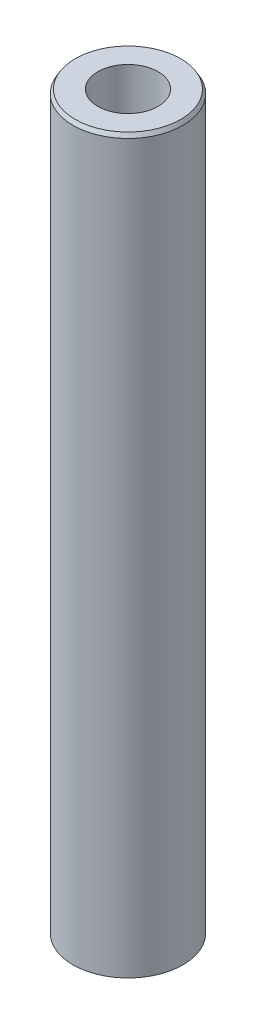
from build123d import *
from OCP.BRepFilletAPI import BRepFilletAPI_MakeChamfer

# Parameters (mm, degrees)
SKETCH1_R           = 45
BOSS_EXTRUDE1_DEPTH = 600
SKETCH2_R           = 24.650377463
CUT_EXTRUDE1_DEPTH  = 604.365560834
CHAMFER1_SIZE       = 3.245424574
CHAMFER1_SIZE2      = 1.873746751


with BuildPart() as part:
    # Sketch1 → Boss-Extrude1 (new body)
    with BuildSketch(Plane(origin=(0, 0, 0), x_dir=(1, 0, 0), z_dir=(0, 1, 0))):
        Circle(SKETCH1_R)
    extrude(amount=BOSS_EXTRUDE1_DEPTH)

    # Sketch2 → Cut-Extrude1 (cut, through all)
    with BuildSketch(Plane(origin=(0, 0, 0), x_dir=(1, 0, 0), z_dir=(0, 1, 0))):
        Circle(SKETCH2_R)
    extrude(amount=CUT_EXTRUDE1_DEPTH, mode=Mode.SUBTRACT)

    # Chamfer1: one chamfer whose edges measure the first distance from different faces: ONE call of the kernel's chamfer builder (chamfer() names one face for all edges)
    chamfer1_edges_1 = [part.edges().sort_by_distance(p)[0] for p in [
        (-45, 600, 0),
    ]]
    chamfer1_side_1 = [part.faces().sort_by_distance(p)[0] for p in [
        (-45, 300, 0),
    ]]
    chamfer1_edges_2 = [part.edges().sort_by_distance(p)[0] for p in [
        (-45, 0, 0),
    ]]
    chamfer1_side_2 = [part.faces().sort_by_distance(p)[0] for p in [
        (-43.727207794, 0, 0),
    ]]
    chamfer1 = BRepFilletAPI_MakeChamfer(part.part.solid().wrapped)
    for e in chamfer1_edges_1:
        chamfer1.Add(CHAMFER1_SIZE, CHAMFER1_SIZE2, e.wrapped, chamfer1_side_1[0].wrapped)  # the first distance lies on this face
    for e in chamfer1_edges_2:
        chamfer1.Add(CHAMFER1_SIZE, CHAMFER1_SIZE2, e.wrapped, chamfer1_side_2[0].wrapped)  # the first distance lies on this face
    add(Compound.cast(chamfer1.Shape()), mode=Mode.REPLACE)


solid = part.part
